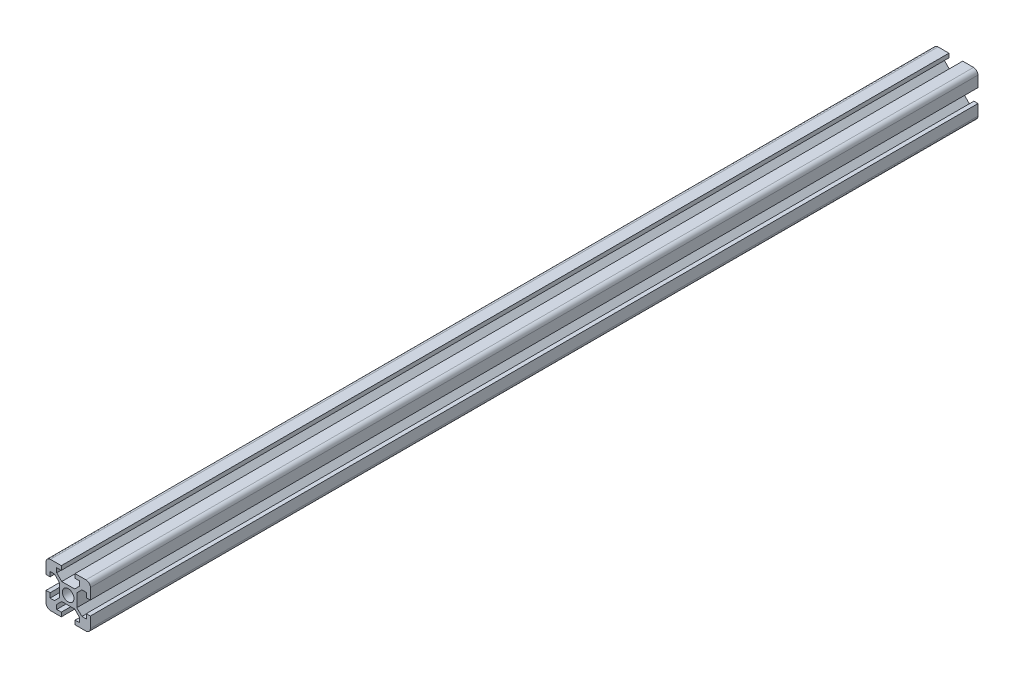
from build123d import *

# Parameters (mm, degrees)
SKETCH1_R           = 2.6
BOSS_EXTRUDE1_DEPTH = 400
FILLET1_R           = 2


with BuildPart() as part:
    # Sketch1 → Boss-Extrude1 (new body)
    with BuildSketch(Plane.XY):
        Polygon((-3.9, 2.910050506), (-6.179949494, 5.19), (-8.15, 5.19), (-8.15, 3.1), (-10, 3.1), (-10, 10), (-3.1, 10), (-3.1, 8.15), (-5.19, 8.15), (-5.19, 6.179949494), (-2.910050506, 3.9), (2.910050506, 3.9), (5.19, 6.179949494), (5.19, 8.15), (3.1, 8.15), (3.1, 10), (10, 10), (10, 3.1), (8.15, 3.1), (8.15, 5.19), (6.179949494, 5.19), (3.9, 2.910050506), (3.9, -2.910050506), (6.179949494, -5.19), (8.15, -5.19), (8.15, -3.1), (10, -3.1), (10, -10), (3.1, -10), (3.1, -8.15), (5.19, -8.15), (5.19, -6.179949494), (2.910050506, -3.9), (-2.910050506, -3.9), (-5.19, -6.179949494), (-5.19, -8.15), (-3.1, -8.15), (-3.1, -10), (-10, -10), (-10, -3.1), (-8.15, -3.1), (-8.15, -5.19), (-6.179949494, -5.19), (-3.9, -2.910050506), align=None)
        Circle(SKETCH1_R, mode=Mode.SUBTRACT)
    extrude(amount=-BOSS_EXTRUDE1_DEPTH)

    # Fillet1
    fillet1_edges = [part.edges().sort_by_distance(p)[0] for p in [
        (10, -10, -200),
        (-10, -10, -200),
        (10, 10, -200),
        (-10, 10, -200),
    ]]
    fillet(fillet1_edges, radius=FILLET1_R)


solid = part.part
